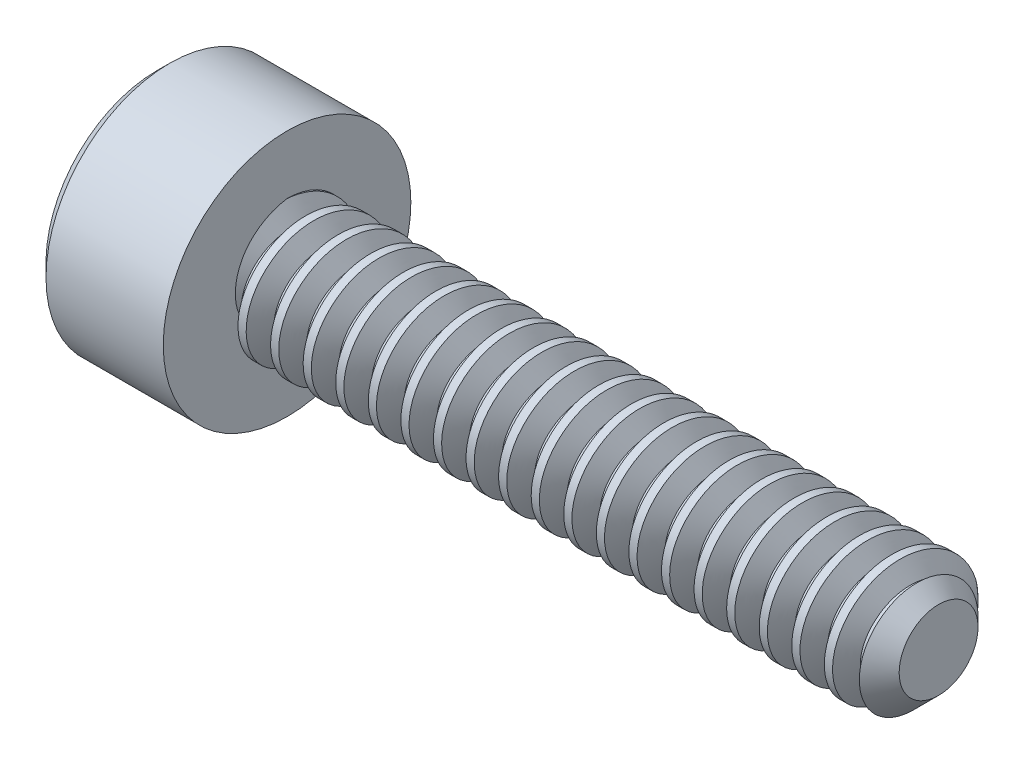
from build123d import *

# Parameters (mm, degrees)
CHAMFER1_SIZE       = 0.395
CUT_SWEEP1_PITCH    = 0.5
BOSS_EXTRUDE1_START = -2
SKETCH6_R           = 1.9
BOSS_EXTRUDE1_DEPTH = 2
CUT_EXTRUDE1_DEPTH  = 1.6
CHAMFER2_SIZE       = 0.2


with BuildPart() as part:
    # Sketch1 → Revolve1 (revolve)
    with BuildSketch(Plane.XY):
        Polygon((0, 0), (0, 1.9), (2, 1.9), (2, 1), (12, 1), (12, 0), align=None)
    revolve(axis=Axis((0, 0, 0), (-1, 0, 0)))

    # Chamfer1
    chamfer1_edges = [part.edges().sort_by_distance(p)[0] for p in [
        (12, -1, 0),
    ]]
    chamfer(chamfer1_edges, length=CHAMFER1_SIZE)

    # Cut-Sweep1: arcs per turn and ends read off the stored shape
    # Cut-Sweep1: the profile of Sketch3 screwed along a left-hand helix through 22 turns, 6 arcs to a turn; built about Z, then put on its axis
    cut_sweep1_z = Axis((0, 0, 0), (0, 0, 1))
    cut_sweep1_corners = [(1.054126588, 0, -0.34375), (1.054126588, 0, -0.78125), (0.729367061, 0, -0.59375), (0.729367061, 0, -0.53125)]
    with BuildLine(mode=Mode.PRIVATE) as cut_sweep1_profile:
        Line(cut_sweep1_corners[0], cut_sweep1_corners[1])
        Line(cut_sweep1_corners[1], cut_sweep1_corners[2])
        Line(cut_sweep1_corners[2], cut_sweep1_corners[3])
        Line(cut_sweep1_corners[3], cut_sweep1_corners[0])
    cut_sweep1_cap = Face(cut_sweep1_profile.wire())
    cut_sweep1_turn_angles = [0, -30, -60, -90, -120, -150, -180, -210, -240, -270, -300, -330, -360]
    cut_sweep1_turn_weights = [1, 0.8660254037844387, 1, 0.8660254037844387, 1, 0.8660254037844387, 1, 0.8660254037844387, 1, 0.8660254037844387, 1, 0.8660254037844387, 1]
    cut_sweep1_turn_rails = [Edge.make_bspline([Vector(p[0], p[1], 0).rotate(cut_sweep1_z, cut_sweep1_turn_angles[k]) / cut_sweep1_turn_weights[k] + Vector(0, 0, p[2] + -CUT_SWEEP1_PITCH * cut_sweep1_turn_angles[k] / 360) for k in range(13)], [0, 0, 0, 1, 1, 2, 2, 3, 3, 4, 4, 5, 5, 6, 6, 6], 2, cut_sweep1_turn_weights) for p in cut_sweep1_corners]
    cut_sweep1_turn_sides = [Face.make_surface_from_curves(cut_sweep1_turn_rails[p[0]], cut_sweep1_turn_rails[p[1]]) for p in [(0, 1), (1, 2), (2, 3), (3, 0)]]
    cut_sweep1 = Plane(origin=(12, 0, 0), x_dir=(0, 0, 1), z_dir=(-1, 0, 0)) * Solid(Shell([*[p.moved(Location((0, 0, CUT_SWEEP1_PITCH * i))) for i in range(22) for p in cut_sweep1_turn_sides], cut_sweep1_cap, cut_sweep1_cap.rotate(cut_sweep1_z, -7920).moved(Location((0, 0, -CUT_SWEEP1_PITCH * -7920 / 360)))]))
    add(cut_sweep1, mode=Mode.SUBTRACT)

    # Sketch6 → Boss-Extrude1 (add)
    with BuildSketch(Plane.ZY.offset(BOSS_EXTRUDE1_START)):
        with Locations(Location((0, 0, 0), (0, 0, 90))):
            Circle(SKETCH6_R)
    extrude(amount=BOSS_EXTRUDE1_DEPTH)

    # Sketch4 → Cut-Extrude1 (cut)
    with BuildSketch(Plane.ZY):
        Polygon((-1.154700538, 0), (-0.577350269, 1), (0.577350269, 1), (1.154700538, 0), (0.577350269, -1), (-0.577350269, -1), align=None)
    extrude(amount=-CUT_EXTRUDE1_DEPTH, mode=Mode.SUBTRACT)

    # Cut-Extrude2 cone 1 section (through the dimple's axis) → Cut-Extrude2 (revolve, cut)
    with BuildSketch(Plane.ZX):
        Polygon((0, 0), (1.154700538, 0), (0, 1.154700538), align=None)
    revolve(axis=Axis((0, 0, 0), (1, 0, 0)), mode=Mode.SUBTRACT)

    # Chamfer2
    chamfer2_edges = [part.edges().sort_by_distance(p)[0] for p in [
        (0, -1.9, 0),
    ]]
    chamfer(chamfer2_edges, length=CHAMFER2_SIZE)


solid = part.part
